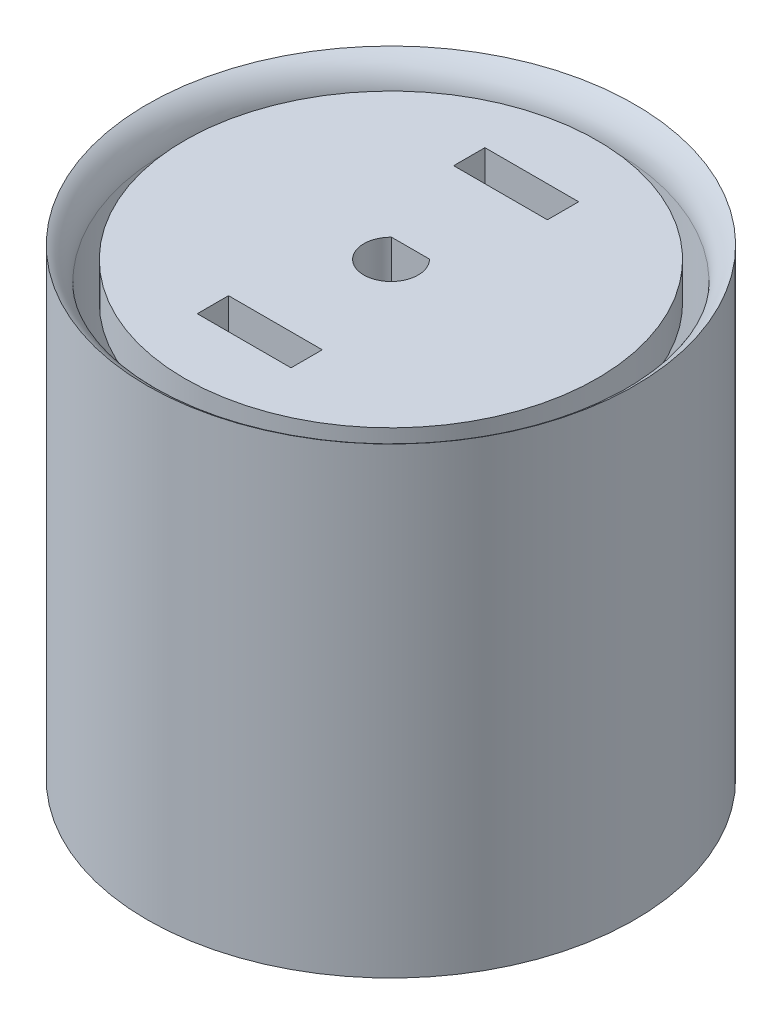
from build123d import *

# Parameters (mm, degrees)
SKETCH1_R           = 17
BOSS_EXTRUDE1_DEPTH = 3
SKETCH3_R           = 17
BOSS_EXTRUDE2_DEPTH = 3
BOSS_EXTRUDE3_DEPTH = 31
SKETCH7_R           = 1.751351815
CUT_EXTRUDE11_DEPTH = 50
CUT_EXTRUDE1_DEPTH  = 50
SKETCH8_W           = 7.5
SKETCH8_H           = 2.5
CUT_EXTRUDE12_DEPTH = 40
SKETCH9_R           = 19.5
SKETCH9_R_2         = 18
BOSS_EXTRUDE4_DEPTH = 37
FILLET1_R           = 3
SKETCH10_R          = 17
SKETCH10_R_2        = 16.5
CUT_EXTRUDE13_DEPTH = 3
SKETCH11_R          = 19.5
BOSS_EXTRUDE5_DEPTH = 3


with BuildPart() as part:
    # Sketch1 → Boss-Extrude1 (new body)
    with BuildSketch(Plane(origin=(0, -15, 0), x_dir=(1, 0, 0), z_dir=(0, 1, 0))):
        with Locations(Location((0, 0, 0), (0, 0, 270))):
            Circle(SKETCH1_R)
    extrude(amount=BOSS_EXTRUDE1_DEPTH)



with BuildPart() as body_2:
    # Sketch3 → Boss-Extrude2 (new body)
    with BuildSketch(Plane(origin=(0, 21, 0), x_dir=(1, 0, 0), z_dir=(0, 1, 0))):
        with Locations(Location((0, 0, 0), (0, 0, 270))):
            Circle(SKETCH3_R)
    extrude(amount=-BOSS_EXTRUDE2_DEPTH)


with BuildPart() as part_1:
    add(part.part)

    add(body_2.part)  # Boss-Extrude3 merges body 2
    # Sketch6 → Boss-Extrude3 (add)
    with BuildSketch(Plane(origin=(0, -12, 0), x_dir=(1, 0, 0), z_dir=(0, 1, 0))):
        Polygon((-10.39609313, -6.860559341), (-11.68775931, -8.152225055), (-12.244775891, -7.288892753), (-12.738139369, -6.387668662), (-13.165283017, -5.453239195), (-13.523988426, -4.490460269), (-13.812389225, -3.504338907), (-14.028987847, -2.499999944), (-12.202296406, -2.499999944), (-12.202296406, 2.499999944), (-14.028987847, 2.499999944), (-13.812389225, 3.504338907), (-13.523988426, 4.490460269), (-13.165283017, 5.453239195), (-12.738139369, 6.387668662), (-12.244775891, 7.288892753), (-11.68775931, 8.152225055), (-10.39609313, 6.860559341), (-6.860559341, 10.39609313), (-8.152225055, 11.68775931), (-7.288892753, 12.244775891), (-6.387668662, 12.738139369), (-5.453239195, 13.165283017), (-4.490460269, 13.523988426), (-3.504338907, 13.812389225), (-2.499999944, 14.028987847), (-2.499999944, 12.174172863), (2.499999944, 12.202296406), (2.499999944, 14.028987847), (3.504338907, 13.812389225), (4.490460269, 13.523988426), (5.453239195, 13.165283017), (6.387668662, 12.738139369), (7.288892753, 12.244775891), (8.152225055, 11.68775931), (6.860559341, 10.39609313), (10.39609313, 6.860559341), (11.68775931, 8.152225055), (12.244775891, 7.288892753), (12.738139369, 6.387668662), (13.165283017, 5.453239195), (13.523988426, 4.490460269), (13.812389225, 3.504338907), (14.028987847, 2.499999944), (12.202296406, 2.499999944), (12.202296406, -2.499999944), (14.028987847, -2.499999944), (13.812389225, -3.504338907), (13.523988426, -4.490460269), (13.165283017, -5.453239195), (12.738139369, -6.387668662), (12.244775891, -7.288892753), (11.68775931, -8.152225055), (10.39609313, -6.860559341), (6.860559341, -10.39609313), (8.152225055, -11.68775931), (7.288892753, -12.244775891), (6.387668662, -12.738139369), (5.453239195, -13.165283017), (4.490460269, -13.523988426), (3.504338907, -13.812389225), (2.499999944, -14.028987847), (2.499999944, -12.202296406), (-2.499999944, -12.202296406), (-2.499999944, -14.028987847), (-3.504338907, -13.812389225), (-4.490460269, -13.523988426), (-5.453239195, -13.165283017), (-6.387668662, -12.738139369), (-7.288892753, -12.244775891), (-8.152225055, -11.68775931), (-6.860559341, -10.39609313), align=None)
    extrude(amount=BOSS_EXTRUDE3_DEPTH)

    # Sketch7 → Cut-Extrude11 (cut)
    with BuildSketch(Plane(origin=(-0.068553102, 0, -12.187849043), x_dir=(-0.9999841817006155, 0, 0.005624619858302935), z_dir=(-0.005624619858302935, 0, -0.9999841817006155))):
        with Locations((-0.120761258, 16)):
            Circle(SKETCH7_R)
    extrude(amount=-CUT_EXTRUDE11_DEPTH, mode=Mode.SUBTRACT)

    # Sketch2 → Cut-Extrude1 (cut)
    with BuildSketch(Plane(origin=(0, -15, 0), x_dir=(1, 0, 0), z_dir=(0, 1, 0))):
        with BuildLine():
            Line((1.514793699, 1.566442938), (-1.521232282, 1.566442938))
            ThreePointArc((-1.521232282, 1.566442938), (-0.003219291, -2.164389177), (1.514793699, 1.566442938))
        make_face()
    extrude(amount=CUT_EXTRUDE1_DEPTH, mode=Mode.SUBTRACT)

    # Sketch8 → Cut-Extrude12 (cut)
    with BuildSketch(Plane(origin=(0, -15, 0), x_dir=(1, 0, 0), z_dir=(0, 1, 0))):
        with Locations((-0.237061367, 10.255385433)):
            Rectangle(SKETCH8_W, SKETCH8_H)
    cut_extrude12 = extrude(amount=CUT_EXTRUDE12_DEPTH, mode=Mode.SUBTRACT)

    # Mirror1: Cut-Extrude12 across plane
    add(cut_extrude12.mirror(Plane.XY), mode=Mode.SUBTRACT)

    # Sketch10 → Cut-Extrude13 (cut)
    with BuildSketch(Plane(origin=(0, 21, 0), x_dir=(1, 0, 0), z_dir=(0, 1, 0))):
        with Locations(Location((0, 0, 0), (0, 0, 270))):
            Circle(SKETCH10_R)
        with Locations(Location((0, 0, 0), (0, 0, 270))):
            Circle(SKETCH10_R_2, mode=Mode.SUBTRACT)
    extrude(amount=-CUT_EXTRUDE13_DEPTH, mode=Mode.SUBTRACT)



with BuildPart() as body_2_2:
    # Sketch9 → Boss-Extrude4 (new body)
    with BuildSketch(Plane(origin=(0, -15, 0), x_dir=(1, 0, 0), z_dir=(0, 1, 0))):
        with Locations(Location((0, 0, 0), (0, 0, 270))):
            Circle(SKETCH9_R)
        with Locations(Location((0, 0, 0), (0, 0, 270))):
            Circle(SKETCH9_R_2, mode=Mode.SUBTRACT)
    extrude(amount=BOSS_EXTRUDE4_DEPTH)

    # Fillet1
    # the kernel refuses this fillet: 3 mm, written as the material it takes off along each edge
    with BuildSketch(Plane(origin=(0, 22, 0), x_dir=(0, 0, 1), z_dir=(-1, 0, 0))) as fillet1_piece_1:
        with BuildLine():
            CenterArc((21, -2.598076211), FILLET1_R, 120, 60)
            Line((19.5, 0), (19.47, 0.051961524))
            ThreePointArc((19.47, 0.051961524), (18.75, 0.06), (18, 0.06))
            Line((18, 0.06), (17.94, 0))
            Line((17.94, 0), (17.94, -2.598076211))
            Line((17.94, -2.598076211), (18, -2.598076211))
        make_face()
    revolve(axis=Axis((0, 22, 0), (0, 1, 0)), mode=Mode.SUBTRACT)


with BuildPart() as part_2:
    add(part_1.part)

    add(body_2_2.part)  # Boss-Extrude5 merges body 2 2
    # Sketch11 → Boss-Extrude5 (add)
    with BuildSketch(Plane(origin=(0, -15, 0), x_dir=(1, 0, 0), z_dir=(0, 1, 0))):
        with Locations(Location((0, 0, 0), (0, 0, 270))):
            Circle(SKETCH11_R)
    extrude(amount=BOSS_EXTRUDE5_DEPTH)


solid = part_2.part
